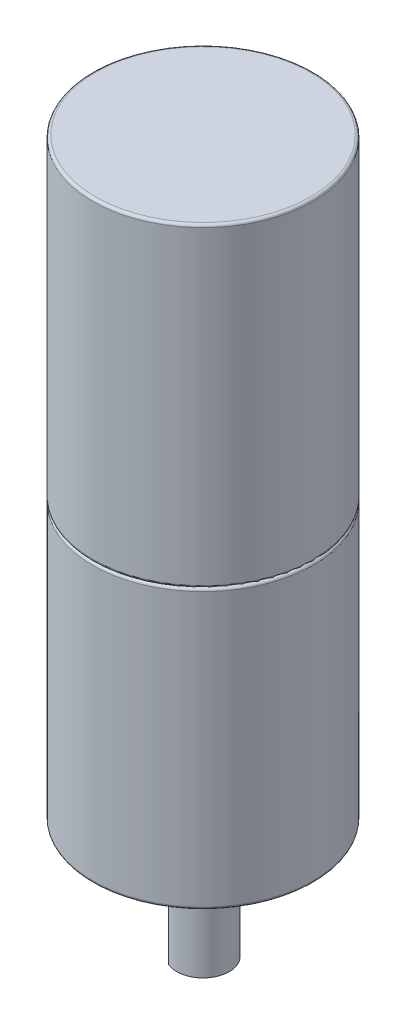
from build123d import *

# Parameters (mm, degrees)
CROQUIS1_R              = 21
SALIENTE_EXTRUIR1_DEPTH = 60
REDONDEO1_R             = 0.5
SALIENTE_EXTRUIR2_START = 53
CROQUIS2_R              = 21
SALIENTE_EXTRUIR2_DEPTH = 53
REDONDEO2_R             = 0.5
SALIENTE_EXTRUIR3_DEPTH = 2
CROQUIS4_R              = 5
SALIENTE_EXTRUIR4_DEPTH = 20.5
CORTAR_EXTRUIR1_START   = -12
CORTAR_EXTRUIR1_DEPTH   = 12
CROQUIS6_R              = 2
CORTAR_EXTRUIR2_DEPTH   = 5


with BuildPart() as part:
    # Croquis1 → Saliente-Extruir1 (new body)
    with BuildSketch(Plane(origin=(0, 0, 0), x_dir=(1, 0, 0), z_dir=(0, 1, 0))):
        with Locations(Location((0, 0, 0), (0, 0, 270))):
            Circle(CROQUIS1_R)
    extrude(amount=SALIENTE_EXTRUIR1_DEPTH)

    # Redondeo1
    redondeo1_edges = [part.edges().sort_by_distance(p)[0] for p in [
        (0, 0, -21),
        (0, 60, -21),
    ]]
    fillet(redondeo1_edges, radius=REDONDEO1_R)

    # Croquis2 → Saliente-Extruir2 (add)
    with BuildSketch(Plane.XZ.offset(SALIENTE_EXTRUIR2_START)):
        with Locations(Location((0, 0, 0), (0, 0, 90))):
            Circle(CROQUIS2_R)
    extrude(amount=-SALIENTE_EXTRUIR2_DEPTH)

    # Redondeo2
    redondeo2_edges = [part.edges().sort_by_distance(p)[0] for p in [
        (0, 0, -21),
        (0, -53, -21),
    ]]
    fillet(redondeo2_edges, radius=REDONDEO2_R - 0.0001)  # a hair under: the kernel refuses the full size

    # Croquis3 → Saliente-Extruir3 (add)
    with BuildSketch(Plane.XZ.offset(53)):
        with BuildLine():
            Line((11.5, -4.898979486), (11.5, 4.898979486))
            ThreePointArc((11.5, 4.898979486), (0, 12.5), (-11.5, 4.898979486))
            Line((-11.5, 4.898979486), (-11.5, -4.898979486))
            ThreePointArc((-11.5, -4.898979486), (0, -12.5), (11.5, -4.898979486))
        make_face()
    extrude(amount=SALIENTE_EXTRUIR3_DEPTH)

    # Croquis4 → Saliente-Extruir4 (add)
    with BuildSketch(Plane.XZ.offset(55)):
        with Locations(Location((0, 0, 0), (0, 0, 270))):
            Circle(CROQUIS4_R)
    extrude(amount=SALIENTE_EXTRUIR4_DEPTH)

    # Croquis5 → Cortar-Extruir1 (cut)
    with BuildSketch(Plane.XZ.offset(75.5).offset(CORTAR_EXTRUIR1_START)):
        with BuildLine():
            Line((-2, 4.582575695), (-2, -4.582575695))
            ThreePointArc((-2, -4.582575695), (-5, 0), (-2, 4.582575695))
        make_face()
    extrude(amount=CORTAR_EXTRUIR1_DEPTH, mode=Mode.SUBTRACT)

    # Croquis6 → Cortar-Extruir2 (cut)
    with BuildSketch(Plane.XZ.offset(53)):
        with Locations(Location((-17.5, 0, 0), (0, 0, 270))):
            Circle(CROQUIS6_R)
        with Locations(Location((0, 17.5, 0), (0, 0, 270))):
            Circle(CROQUIS6_R)
        with Locations(Location((17.5, 0, 0), (0, 0, 270))):
            Circle(CROQUIS6_R)
        with Locations(Location((0, -17.5, 0), (0, 0, 270))):
            Circle(CROQUIS6_R)
    extrude(amount=-CORTAR_EXTRUIR2_DEPTH, mode=Mode.SUBTRACT)


solid = part.part
